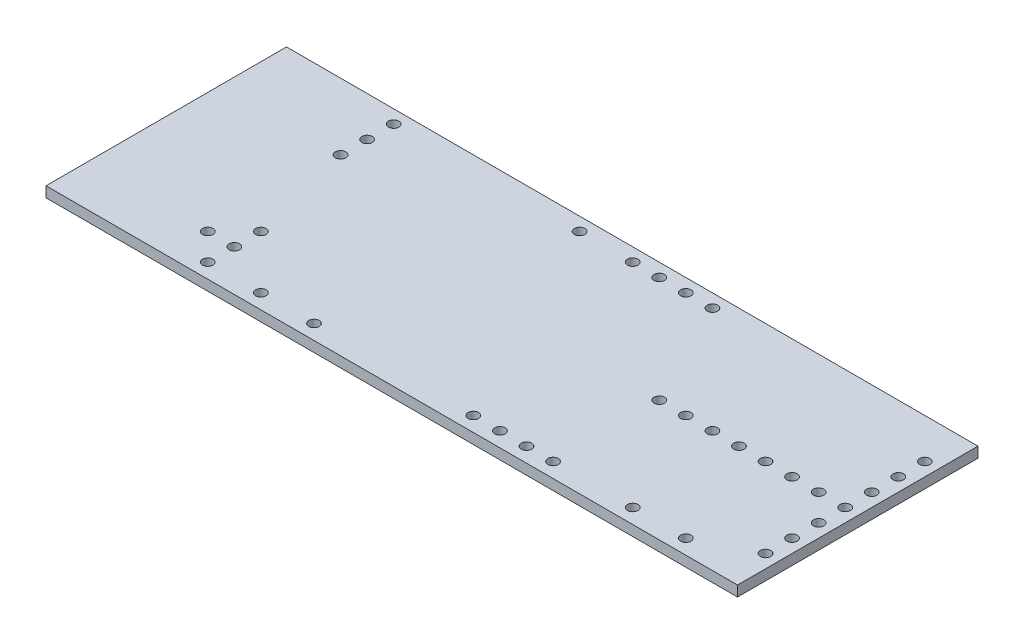
from build123d import *

# Parameters (mm, degrees)
SKETCH1_W           = 58.5
SKETCH1_H           = 23
BOSS_EXTRUDE1_DEPTH = 1
SKETCH2_R           = 0.5
CUT_EXTRUDE1_DEPTH  = 63.86692294
SKETCH3_W           = 23
SKETCH3_H           = 1
BOSS_EXTRUDE2_DEPTH = 7.63


with BuildPart() as part:
    # Sketch1 → Boss-Extrude1 (new body)
    with BuildSketch(Plane(origin=(0, 0, 0), x_dir=(1, 0, 0), z_dir=(0, 1, 0))):
        with Locations((29.25, -11.5)):
            Rectangle(SKETCH1_W, SKETCH1_H)
    extrude(amount=BOSS_EXTRUDE1_DEPTH)

    # Sketch2 → Cut-Extrude1 (cut, through all)
    with BuildSketch(Plane(origin=(0, 1, 0), x_dir=(1, 0, 0), z_dir=(0, 1, 0))):
        with Locations((57.23, -3.81)):
            Circle(SKETCH2_R)
        with Locations((57.23, -6.35)):
            Circle(SKETCH2_R)
        with Locations((57.23, -8.89)):
            Circle(SKETCH2_R)
        with Locations((57.23, -11.43)):
            Circle(SKETCH2_R)
        with Locations((57.23, -13.97)):
            Circle(SKETCH2_R)
        with Locations((57.23, -16.51)):
            Circle(SKETCH2_R)
        with Locations((57.23, -19.05)):
            Circle(SKETCH2_R)
        with Locations((54.69, -11.43)):
            Circle(SKETCH2_R)
        with Locations((52.15, -11.43)):
            Circle(SKETCH2_R)
        with Locations((49.61, -11.43)):
            Circle(SKETCH2_R)
        with Locations((47.07, -11.43)):
            Circle(SKETCH2_R)
        with Locations((44.53, -11.43)):
            Circle(SKETCH2_R)
        with Locations((41.99, -11.43)):
            Circle(SKETCH2_R)
        with Locations((39.45, -11.43)):
            Circle(SKETCH2_R)
        with Locations((39.45, -21.59)):
            Circle(SKETCH2_R)
        with Locations((36.91, -21.59)):
            Circle(SKETCH2_R)
        with Locations((34.37, -21.59)):
            Circle(SKETCH2_R)
        with Locations((31.83, -21.59)):
            Circle(SKETCH2_R)
        with Locations((16.59, -21.59)):
            Circle(SKETCH2_R)
        with Locations((11.51, -21.59)):
            Circle(SKETCH2_R)
        with Locations((6.43, -21.59)):
            Circle(SKETCH2_R)
        with Locations((47.07, -21.59)):
            Circle(SKETCH2_R)
        with Locations((52.15, -21.59)):
            Circle(SKETCH2_R)
        with Locations((6.43, -19.05)):
            Circle(SKETCH2_R)
        with Locations((6.43, -16.51)):
            Circle(SKETCH2_R)
        with Locations((3.89, -19.05)):
            Circle(SKETCH2_R)
        with Locations((3.89, -6.35)):
            Circle(SKETCH2_R)
        with Locations((3.89, -3.81)):
            Circle(SKETCH2_R)
        with Locations((3.89, -1.27)):
            Circle(SKETCH2_R)
        with Locations((21.67, -1.27)):
            Circle(SKETCH2_R)
        with Locations((26.75, -1.27)):
            Circle(SKETCH2_R)
        with Locations((29.29, -1.27)):
            Circle(SKETCH2_R)
        with Locations((31.83, -1.27)):
            Circle(SKETCH2_R)
        with Locations((34.37, -1.27)):
            Circle(SKETCH2_R)
    extrude(amount=-CUT_EXTRUDE1_DEPTH, mode=Mode.SUBTRACT)

    # Sketch3 → Boss-Extrude2 (add)
    with BuildSketch(Plane.ZY):
        with Locations((11.5, 0.5)):
            Rectangle(SKETCH3_W, SKETCH3_H)
    extrude(amount=BOSS_EXTRUDE2_DEPTH)


solid = part.part
